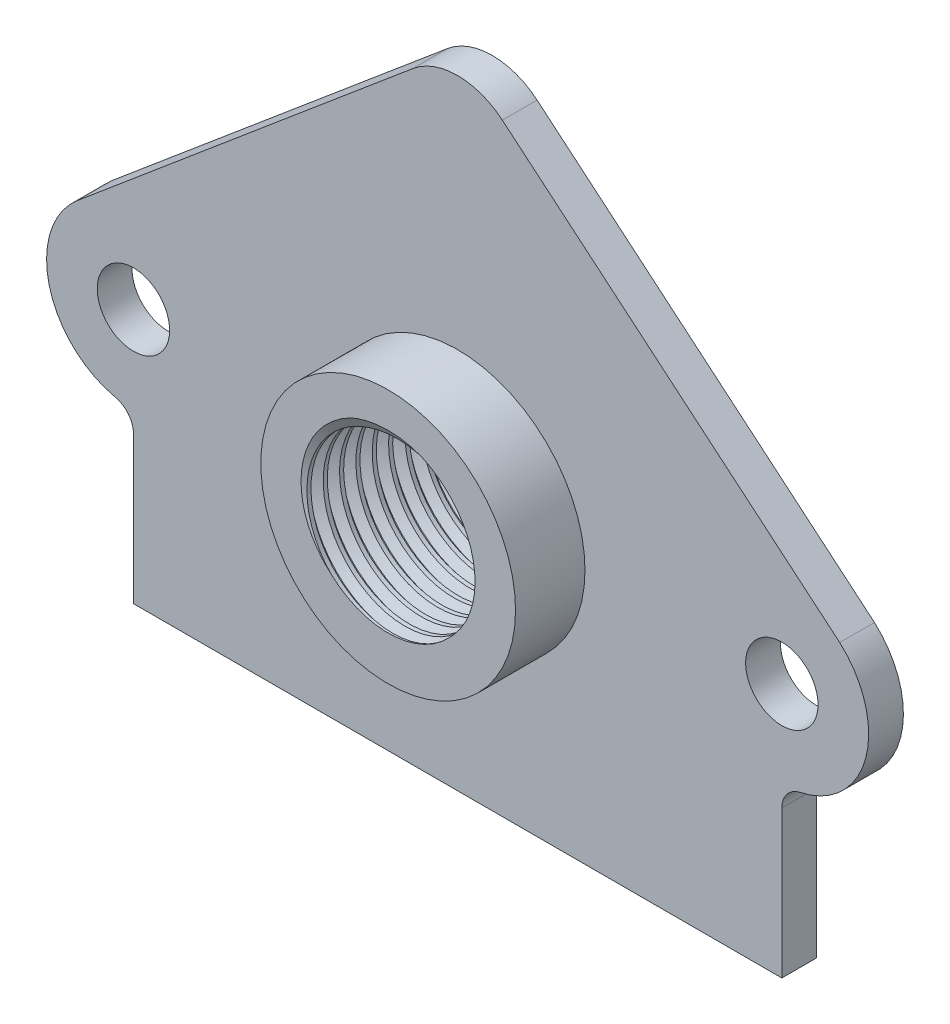
from build123d import *
from build123d.topology import SkipClean

# Parameters (mm, degrees)
SKETCH2_R           = 3.125
SKETCH2_R_2         = 7.2
BOSS_EXTRUDE2_DEPTH = 3
BOSS_EXTRUDE3_START = 6
SKETCH5_R           = 11
SKETCH5_R_2         = 7.2
BOSS_EXTRUDE3_DEPTH = 6
SKETCH6_R           = 11
SKETCH6_R_2         = 7.2
BOSS_EXTRUDE4_DEPTH = 6
FILLET1_R           = 2
THREAD1_PITCH       = 1.411111111


with BuildPart() as part:
    # Sketch2 → Boss-Extrude2 (new body)
    # profile 1 of 2: a face of its own
    with BuildSketch(Plane.XY):
        with BuildLine():
            ThreePointArc((3.861106297, 30.092587306), (0, 31.5), (-3.861106297, 30.092587306))
            Line((-3.861106297, 30.092587306), (-32.826382871, 5.740734133))
            ThreePointArc((-32.826382871, 5.740734133), (-35.046470961, -2.568510658), (-28, -7.5))
            Line((-28, -7.5), (-28, -22))
            Line((-28, -22), (28, -22))
            Line((28, -22), (28, -7.5))
            ThreePointArc((28, -7.5), (35.006811058, -2.674808179), (32.997833475, 5.592106988))
            Line((32.997833475, 5.592106988), (32.651575677, 5.883268116))
            Line((32.651575677, 5.883268116), (3.86193439, 30.091890979))
            Line((3.86193439, 30.091890979), (3.861106297, 30.092587306))
        make_face()
        with Locations((-28, 0)):
            Circle(SKETCH2_R, mode=Mode.SUBTRACT)
        with BuildLine():
            ThreePointArc((0, -11), (-0.700886243, -10.97764813), (-1.3989241, -10.910683359))
            ThreePointArc((-1.3989241, -10.910683359), (-7.266768019, 8.25797085), (11, 0))
            ThreePointArc((11, 0), (7.778174593, -7.778174593), (0, -11))
        make_face(mode=Mode.SUBTRACT)
        with Locations((28, 0)):
            Circle(SKETCH2_R, mode=Mode.SUBTRACT)
    # profile 2 of 2: a face of its own
    with BuildSketch(Plane.XY):
        with BuildLine():
            ThreePointArc((11, 0), (-7.266768019, 8.25797085), (-1.3989241, -10.910683359))
            ThreePointArc((-1.3989241, -10.910683359), (-0.700886243, -10.97764813), (0, -11))
            ThreePointArc((0, -11), (7.778174593, -7.778174593), (11, 0))
        make_face()
        Circle(SKETCH2_R_2, mode=Mode.SUBTRACT)
    extrude(amount=BOSS_EXTRUDE2_DEPTH)

    # Sketch5 → Boss-Extrude3 (add)
    with SkipClean():  # the faces are left unmerged after this step: merging them gives an invalid solid
        with BuildSketch(Plane(origin=(0, 0, 0), x_dir=(-1, 0, 0), z_dir=(0, 0, -1)).offset(BOSS_EXTRUDE3_START)):
            with Locations(Location((0, 0, 0), (0, 0, 180))):
                Circle(SKETCH5_R)
            Circle(SKETCH5_R_2, mode=Mode.SUBTRACT)
        extrude(amount=-BOSS_EXTRUDE3_DEPTH)

    # Sketch6 → Boss-Extrude4 (add)
    with BuildSketch(Plane.XY.offset(3)):
        Circle(SKETCH6_R)
        with Locations(Location((0, 0, 0), (0, 0, 180))):
            Circle(SKETCH6_R_2, mode=Mode.SUBTRACT)
    extrude(amount=BOSS_EXTRUDE4_DEPTH)

    # Fillet1
    fillet1_edges = [part.edges().sort_by_distance(p)[0] for p in [
        (-28, -7.5, 1.5),
        (28, -7.5, 1.5),
    ]]
    fillet(fillet1_edges, radius=FILLET1_R)

    # Thread1: the profile of Thread Profile1 profile screwed along a right-hand helix of 11.629134 turns, 8 arcs to a turn; built about Z, then put on its axis
    thread1_z = Axis((0, 0, 0), (0, 0, 1))
    thread1_corners = [(7.1997, 0, -0.000173205), (7.96378629, 0, 0.44097222), (7.96378629, 0, 0.617361109), (7.1997, 0, 1.058506535)]
    with BuildLine(mode=Mode.PRIVATE) as thread1_profile:
        Line(thread1_corners[0], thread1_corners[1])
        Line(thread1_corners[1], thread1_corners[2])
        Line(thread1_corners[2], thread1_corners[3])
        Line(thread1_corners[3], thread1_corners[0])
    thread1_cap = Face(thread1_profile.wire())
    thread1_turn_angles = [0, 22.5, 45, 67.5, 90, 112.5, 135, 157.5, 180, 202.5, 225, 247.5, 270, 292.5, 315, 337.5, 360]
    thread1_turn_weights = [1, 0.9238795325112867, 1, 0.9238795325112867, 1, 0.9238795325112867, 1, 0.9238795325112867, 1, 0.9238795325112867, 1, 0.9238795325112867, 1, 0.9238795325112867, 1, 0.9238795325112867, 1]
    thread1_turn_rails = [Edge.make_bspline([Vector(p[0], p[1], 0).rotate(thread1_z, thread1_turn_angles[k]) / thread1_turn_weights[k] + Vector(0, 0, p[2] + THREAD1_PITCH * thread1_turn_angles[k] / 360) for k in range(17)], [0, 0, 0, 1, 1, 2, 2, 3, 3, 4, 4, 5, 5, 6, 6, 7, 7, 8, 8, 8], 2, thread1_turn_weights) for p in thread1_corners]
    thread1_turn_sides = [Face.make_surface_from_curves(thread1_turn_rails[p[0]], thread1_turn_rails[p[1]]) for p in [(0, 1), (1, 2), (2, 3), (3, 0)]]
    thread1_last_angles = [3960, 3982.5, 4005, 4027.5, 4050, 4072.5, 4095, 4117.5, 4140, 4162.5, 4185, 4185.744094488, 4186.488188976]
    thread1_last_weights = [1, 0.9238795325112867, 1, 0.9238795325112867, 1, 0.9238795325112867, 1, 0.9238795325112867, 1, 0.9238795325112867, 1, 0.9999156714154809, 1]
    thread1_last_rails = [Edge.make_bspline([Vector(p[0], p[1], 0).rotate(thread1_z, thread1_last_angles[k]) / thread1_last_weights[k] + Vector(0, 0, p[2] + THREAD1_PITCH * thread1_last_angles[k] / 360) for k in range(13)], [0, 0, 0, 1, 1, 2, 2, 3, 3, 4, 4, 5, 5, 6, 6, 6], 2, thread1_last_weights) for p in thread1_corners]
    thread1_last_sides = [Face.make_surface_from_curves(thread1_last_rails[p[0]], thread1_last_rails[p[1]]) for p in [(0, 1), (1, 2), (2, 3), (3, 0)]]
    thread1 = Plane(origin=(0, 0, -7.41), x_dir=(1, 0, 0), z_dir=(0, 0, 1)) * Solid(Shell([*[p.moved(Location((0, 0, THREAD1_PITCH * i))) for i in range(11) for p in thread1_turn_sides], *thread1_last_sides, thread1_cap, thread1_cap.rotate(thread1_z, 4186.488188976).moved(Location((0, 0, THREAD1_PITCH * 4186.488188976 / 360)))]))
    add(thread1, mode=Mode.SUBTRACT)


solid = part.part
